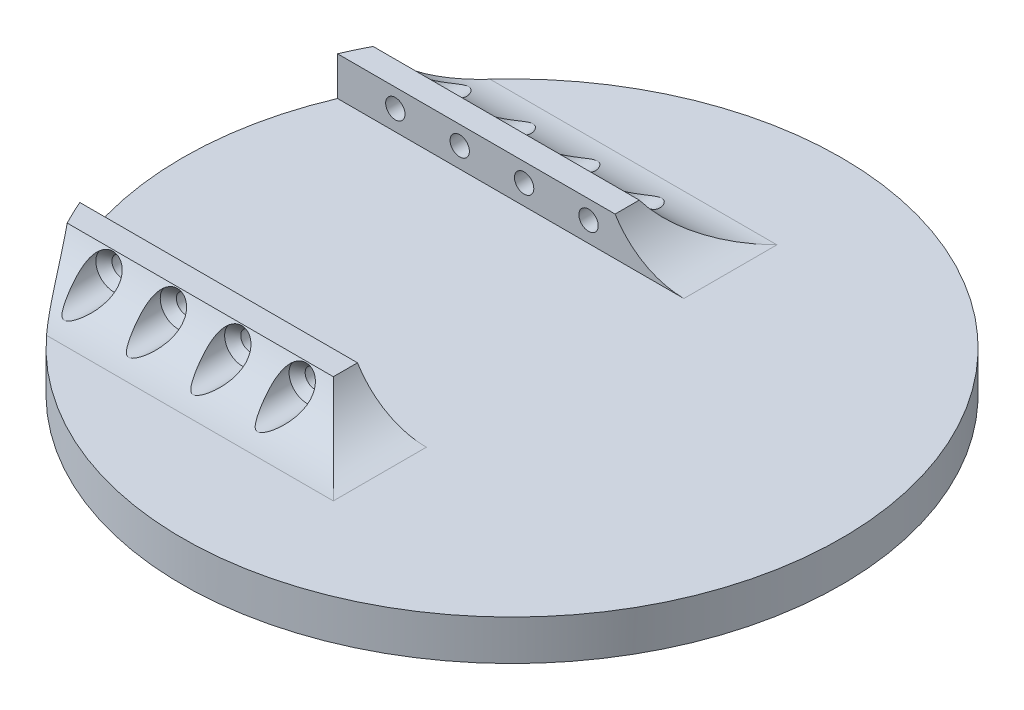
from build123d import *

# Parameters (mm, degrees)
SKETCH2_W           = 34.480194164
SKETCH2_H           = 4.812435565
BOSS_EXTRUDE1_DEPTH = 3
FILLET1_R           = 10
SKETCH8_R           = 2.2
CUT_EXTRUDE1_DEPTH  = 13
LPATTERN1_COUNT     = 4
LPATTERN1_PITCH     = 8
CUT_EXTRUDE2_DEPTH  = 13
FILLET2_START       = 16
FILLET2_DEPTH       = 11.549220739
FILLET2_START_2     = -3.2
FILLET2_2_DEPTH     = 8.549220739


with BuildPart() as part:
    # Sketch1 → Revolve1 (revolve)
    with BuildSketch(Plane.XY, mode=Mode.PRIVATE) as revolve1_sk:
        Polygon((0, 0), (22.9365, 0), (22.9365, 7), (40.9365, 7), (40.9365, 12), (0, 12), align=None)
    revolve(revolve1_sk.sketch.rotate(Axis((0, 0, 0), (0, 1, 0)), 90), axis=Axis((0, 0, 0), (0, 1, 0)))

    # Sketch2 → Boss-Extrude1 (add)
    with BuildSketch(Plane.XY.offset(16)):
        with Locations((-20.440097082, 14.406217783)):
            Rectangle(SKETCH2_W, SKETCH2_H)
    extrude(amount=BOSS_EXTRUDE1_DEPTH)

    # Fillet1
    # the kernel refuses this fillet: 10 mm, written as the material it adds along each edge
    with BuildSketch(Plane(origin=(-3.2, 12, 19), x_dir=(0, 0, 1), z_dir=(-1, 0, 0))) as fillet1_piece_1_section:
        with BuildLine():
            CenterArc((8.549220739, 10), FILLET1_R, 211.248873094, 58.751126906)
            Line((0, 4.812435565), (0, 0))
            Line((0, 0), (8.549220739, 0))
        make_face()
    fillet1_piece_1 = extrude(amount=54.43318191, mode=Mode.PRIVATE)
    fillet1_piece_1 = fillet1_piece_1 & Plane(origin=(0, 12, 0), x_dir=(0, 0, -1), z_dir=(0, 1, 0)) * Cylinder(40.9365, 144, mode=Mode.PRIVATE)
    add(fillet1_piece_1)

    # Sketch7 → CSK for M2 Countersunk Flat Head Screw2 (revolve, cut)
    with BuildSketch(Plane(origin=(-30.5, 14.5, 19), x_dir=(0, -1, 0), z_dir=(1, 0, 0))):
        Polygon((0, 0), (0, 59.9365), (1.2, 59.9365), (1.2, 1), (2.2, 0), align=None)
    csk_for_m2_countersunk_flat_head_screw2 = revolve(axis=Axis((-30.5, 14.5, 25.35), (0, 0, -1)), mode=Mode.SUBTRACT)

    # Sketch8 → Cut-Extrude1 (cut)
    with BuildSketch(Plane.XY.offset(19)):
        with Locations(Location((-30.5, 14.5, 0), (0, 0, 180))):
            Circle(SKETCH8_R)
    cut_extrude1 = extrude(amount=CUT_EXTRUDE1_DEPTH, mode=Mode.SUBTRACT)

    # LPattern1: CSK for M2 Countersunk Flat Head Screw2, Cut-Extrude1 ×4
    with Locations(*[(i * LPATTERN1_PITCH, 0, 0) for i in range(1, LPATTERN1_COUNT)]):
        add(csk_for_m2_countersunk_flat_head_screw2, mode=Mode.SUBTRACT)
        add(cut_extrude1, mode=Mode.SUBTRACT)

    # Sketch10 → Cut-Extrude2 (cut)
    with BuildSketch(Plane(origin=(0, 16.812435565, 0), x_dir=(1, 0, 0), z_dir=(0, 1, 0))):
        with BuildLine():
            Line((-37.680194164, -19), (-36.260130064, -19))
            ThreePointArc((-36.260130064, -19), (-37.000579546, -17.514398234), (-37.680194164, -16))
            Line((-37.680194164, -16), (-37.680194164, -19))
        make_face()
    extrude(amount=-CUT_EXTRUDE2_DEPTH, mode=Mode.SUBTRACT)

    # Fillet2: read off the stored shape, not the designer's step
    # Fillet2 outline → Fillet2 (add)
    with BuildSketch(Plane.XY.offset(FILLET2_START)):
        with BuildLine():
            ThreePointArc((5.349220739, 12), (0.443899361, 13.285768986), (-3.2, 16.812435565))
            Line((-3.2, 16.812435565), (-3.2, 12))
            Line((-3.2, 12), (5.349220739, 12))
        make_face()
    extrude(amount=FILLET2_DEPTH)

    # Fillet2 2 outline → Fillet2 2 (cut)
    with BuildSketch(Plane.YZ.offset(FILLET2_START_2)):
        with BuildLine():
            Line((18, 27.549220739), (12, 27.549220739))
            ThreePointArc((12, 27.549220739), (13.285768986, 22.643899361), (16.812435565, 19))
            Line((16.812435565, 19), (18, 18.279400168))
            Line((18, 18.279400168), (18, 27.549220739))
        make_face()
    extrude(amount=FILLET2_2_DEPTH, mode=Mode.SUBTRACT)

    # Mirror1: read off the stored shape, not the designer's step
    # Mirror1: part across plane


with BuildPart() as part_1:
    add(part.part)
    add(part.part.mirror(Plane.XY))


solid = part_1.part
